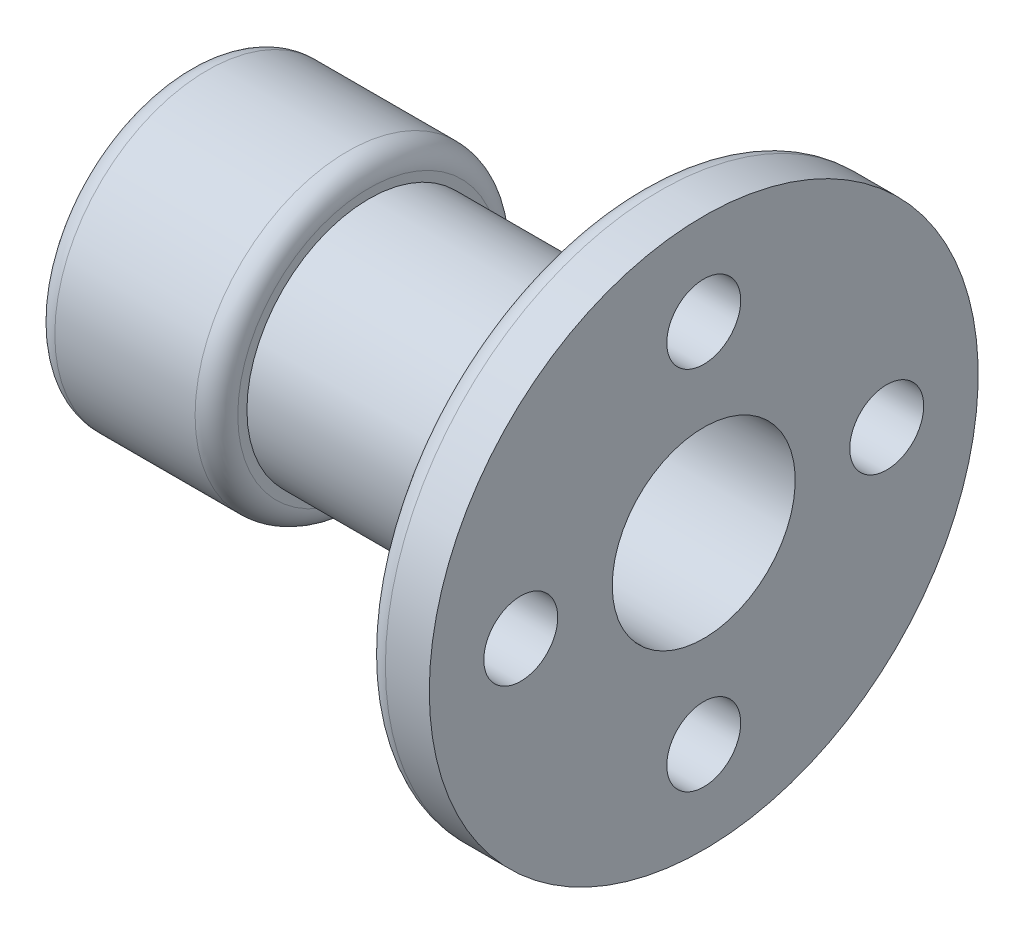
from build123d import *

# Parameters (mm, degrees)
SKETCH2_W          = 10.7
SKETCH2_H          = 7.5
CUT_EXTRUDE2_REACH = 108.104
SKETCH5_R          = 6.061151683
FILLET2_R          = 3.5
FILLET3_R          = 3.5


with BuildPart() as part:
    # Sketch2 → Revolve5 (revolve)
    with BuildSketch(Plane(origin=(0, 0, 0), x_dir=(1, 0, 0), z_dir=(0, 1, 0))):
        Polygon((-50.344444444, 25), (-50.344444444, 19), (-26.344444444, 19), (-26.344444444, 15), (34.555555556, 15), (34.555555556, 25), (23.855555556, 25), (23.855555556, 20), (-20.344444444, 20), (-20.344444444, 25), align=None)
        Polygon((-26.344444444, -15), (-26.344444444, -19), (-50.344444444, -19), (-50.344444444, -25), (-20.344444444, -25), (-20.344444444, -20), (23.855555556, -20), (23.855555556, -45), (34.555555556, -45), (34.555555556, -15), align=None)
        with Locations((29.205555556, 41.25)):
            Rectangle(SKETCH2_W, SKETCH2_H)
    revolve(axis=Axis((-47.361111111, 0, 0), (1, 0, 0)))

    # Sketch5 → Cut-Extrude2 (cut, up to next)
    with BuildSketch(Plane(origin=(34.555555556, 0, 0), x_dir=(0, 0, -1), z_dir=(1, 0, 0)), mode=Mode.PRIVATE) as cut_extrude2_sk1:
        with Locations((0, 30)):
            Circle(SKETCH5_R)
    cut_extrude2_tool1 = extrude(cut_extrude2_sk1.sketch, amount=-CUT_EXTRUDE2_REACH, mode=Mode.PRIVATE) & part.part
    # Sketch5 → Cut-Extrude2 (cut, up to next)
    with BuildSketch(Plane(origin=(34.555555556, 0, 0), x_dir=(0, 0, -1), z_dir=(1, 0, 0)), mode=Mode.PRIVATE) as cut_extrude2_sk2:
        with Locations((30, 0)):
            Circle(SKETCH5_R)
    cut_extrude2_tool2 = extrude(cut_extrude2_sk2.sketch, amount=-CUT_EXTRUDE2_REACH, mode=Mode.PRIVATE) & part.part
    # Sketch5 → Cut-Extrude2 (cut, up to next)
    with BuildSketch(Plane(origin=(34.555555556, 0, 0), x_dir=(0, 0, -1), z_dir=(1, 0, 0)), mode=Mode.PRIVATE) as cut_extrude2_sk3:
        with Locations((0, -30)):
            Circle(SKETCH5_R)
    cut_extrude2_tool3 = extrude(cut_extrude2_sk3.sketch, amount=-CUT_EXTRUDE2_REACH, mode=Mode.PRIVATE) & part.part
    # Sketch5 → Cut-Extrude2 (cut, up to next)
    with BuildSketch(Plane(origin=(34.555555556, 0, 0), x_dir=(0, 0, -1), z_dir=(1, 0, 0)), mode=Mode.PRIVATE) as cut_extrude2_sk4:
        with Locations((-30, 0)):
            Circle(SKETCH5_R)
    cut_extrude2_tool4 = extrude(cut_extrude2_sk4.sketch, amount=-CUT_EXTRUDE2_REACH, mode=Mode.PRIVATE) & part.part
    add(cut_extrude2_tool1.solids().sort_by_distance((34.555556, 30, 0))[0], mode=Mode.SUBTRACT)
    add(cut_extrude2_tool2.solids().sort_by_distance((34.555556, 0, -30))[0], mode=Mode.SUBTRACT)
    add(cut_extrude2_tool3.solids().sort_by_distance((34.555556, -30, 0))[0], mode=Mode.SUBTRACT)
    add(cut_extrude2_tool4.solids().sort_by_distance((34.555556, 0, 30))[0], mode=Mode.SUBTRACT)

    # Fillet2
    fillet2_edges = [part.edges().sort_by_distance(p)[0] for p in [
        (-20.344444444, 0, 25),
    ]]
    fillet(fillet2_edges, radius=FILLET2_R)

    # Fillet3
    fillet3_edges = [part.edges().sort_by_distance(p)[0] for p in [
        (23.855555556, 0, -45),
        (23.855555556, 0, 20),
        (-50.344444444, 0, 25),
    ]]
    fillet(fillet3_edges, radius=FILLET3_R)


solid = part.part
